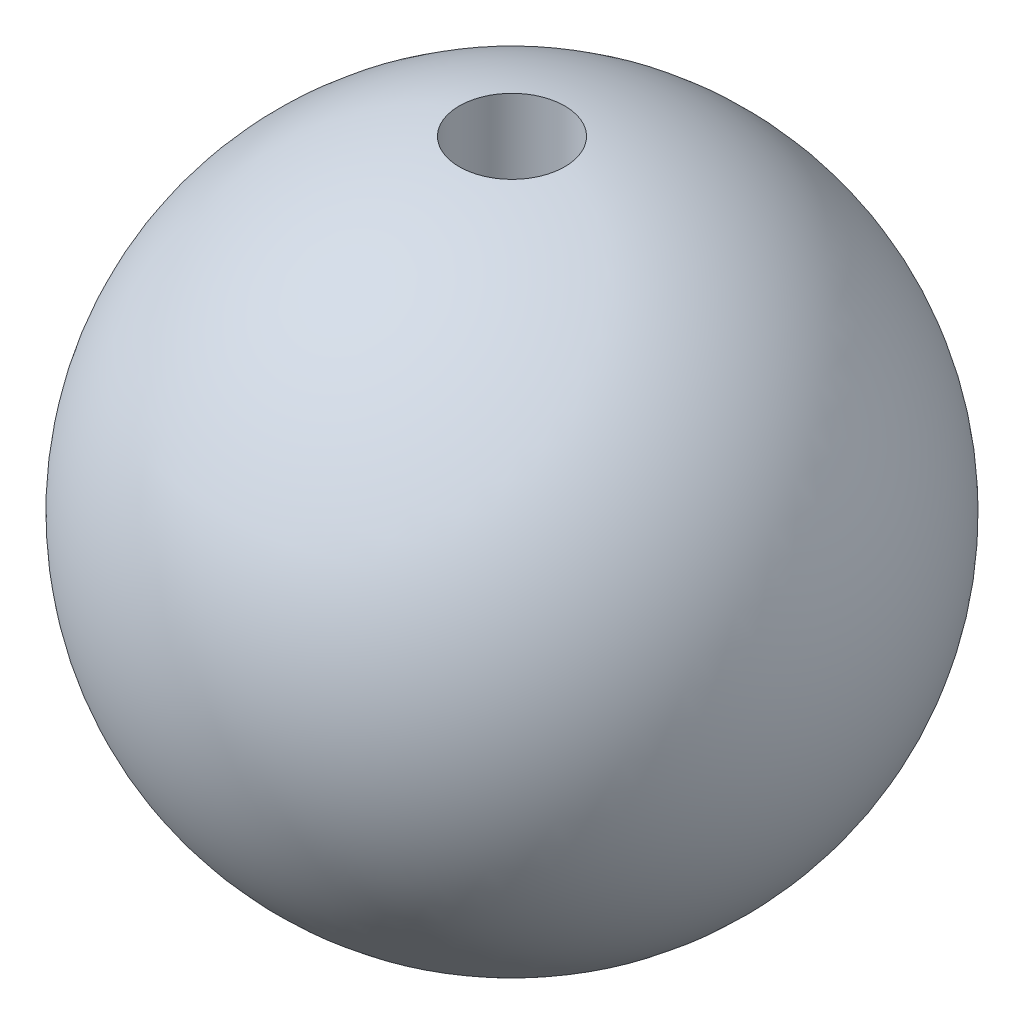
from build123d import *

# Parameters (mm, degrees)
SKETCH2_R          = 4
CUT_EXTRUDE1_DEPTH = 44.301270189


with BuildPart() as part:
    # Sketch1 → Revolve1 (revolve)
    with BuildSketch(Plane.XY):
        with BuildLine():
            Line((0, 25), (0, -25))
            ThreePointArc((0, -25), (25, 0), (0, 25))
        make_face()
    revolve(axis=Axis((0, -541.852730073, 0), (0, 1, 0)))

    # Sketch2 → Cut-Extrude1 (cut, through all)
    with BuildSketch(Plane(origin=(0, 0, 0), x_dir=(1, 0, 0), z_dir=(0, 1, 0))):
        Circle(SKETCH2_R)
    extrude(amount=CUT_EXTRUDE1_DEPTH, mode=Mode.SUBTRACT)


solid = part.part
